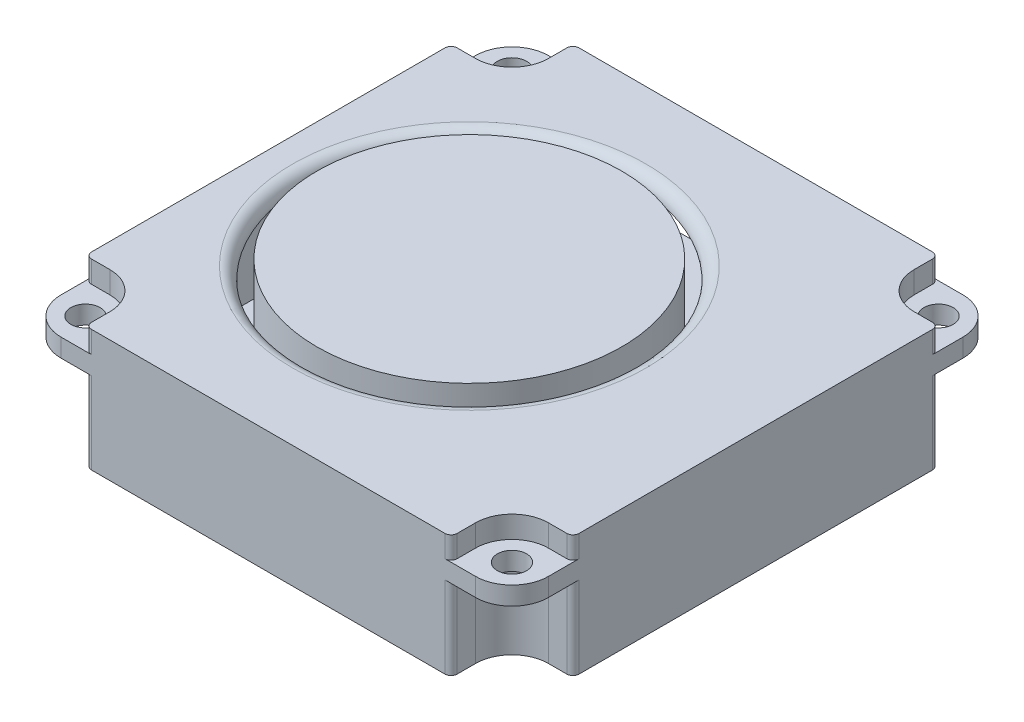
from build123d import *

# Parameters (mm, degrees)
SKETCH_1_W          = 40
SKETCH_1_H          = 40
EXTRUDE_1_DEPTH     = 5
SKETCH_2_W          = 5
SKETCH_2_H          = 5
CUT_EXTRUDE_1_DEPTH = 1.8
SKETCH_4_W          = 5
SKETCH_4_H          = 5
CUT_EXTRUDE_2_DEPTH = 6.7
FILLET_1_R          = 3
HOLE_WIZARD_M2_1_D  = 2.4
FILLET_2_R          = 0.5
CUT_EXTRUDE_3_DEPTH = 4
SKETCH_7_R          = 13.5
CUT_EXTRUDE_4_DEPTH = 9
FILLET_3_R          = 1
SKETCH_9_R          = 12.5
EXTRUDE_2_DEPTH     = 9.5


with BuildPart() as part:
    # ｽｹｯﾁ1 → ﾎﾞｽ - 押し出し1 (new, symmetric)
    with BuildSketch(Plane(origin=(0, 0, 0), x_dir=(1, 0, 0), z_dir=(0, 1, 0))):
        Rectangle(SKETCH_1_W, SKETCH_1_H)
    extrude(amount=EXTRUDE_1_DEPTH, both=True)

    # ｽｹｯﾁ2 → ｶｯﾄ - 押し出し1 (cut)
    with BuildSketch(Plane(origin=(0, 5, 0), x_dir=(1, 0, 0), z_dir=(0, 1, 0))):
        with Locations((17.5, 17.5)):
            Rectangle(SKETCH_2_W, SKETCH_2_H)
        with Locations((-17.5, 17.5)):
            Rectangle(SKETCH_2_W, SKETCH_2_H)
        with Locations((-17.5, -17.5)):
            Rectangle(SKETCH_2_W, SKETCH_2_H)
        with Locations((17.5, -17.5)):
            Rectangle(SKETCH_2_W, SKETCH_2_H)
    extrude(amount=-CUT_EXTRUDE_1_DEPTH, mode=Mode.SUBTRACT)

    # ｽｹｯﾁ4 → ｶｯﾄ - 押し出し2 (cut)
    with BuildSketch(Plane.XZ.offset(5)):
        with Locations((17.5, -17.5)):
            Rectangle(SKETCH_4_W, SKETCH_4_H)
        with Locations((17.5, 17.5)):
            Rectangle(SKETCH_4_W, SKETCH_4_H)
        with Locations((-17.5, 17.5)):
            Rectangle(SKETCH_4_W, SKETCH_4_H)
        with Locations((-17.5, -17.5)):
            Rectangle(SKETCH_4_W, SKETCH_4_H)
    extrude(amount=-CUT_EXTRUDE_2_DEPTH, mode=Mode.SUBTRACT)

    # ﾌｨﾚｯﾄ1
    fillet_1_edges = [part.edges().sort_by_distance(p)[0] for p in [
        (-15, -1.65, -15),
        (20, 2.45, -20),
        (15, 4.1, -15),
        (-20, 2.45, -20),
        (20, 2.45, 20),
        (-20, 2.45, 20),
        (-15, 4.1, -15),
        (-15, 4.1, 15),
        (15, 4.1, 15),
        (15, -1.65, -15),
        (15, -1.65, 15),
        (-15, -1.65, 15),
    ]]
    fillet(fillet_1_edges, radius=FILLET_1_R)

    # M2 すきま穴1 (through all)
    with Locations(Plane(origin=(0, 3.2, 0), x_dir=(1, 0, 0), z_dir=(0, 1, 0))):
        with Locations((-17.5, -17.5), (-17.5, 17.5), (17.5, 17.5), (17.5, -17.5)):
            Hole(HOLE_WIZARD_M2_1_D / 2)

    # ﾌｨﾚｯﾄ2
    fillet_2_edges = [part.edges().sort_by_distance(p)[0] for p in [
        (-15, -1.65, -20),
        (-20, -1.65, -15),
        (20, 4.1, -15),
        (15, 4.1, -20),
        (-15, 4.1, -20),
        (-20, 4.1, -15),
        (-20, 4.1, 15),
        (-15, 4.1, 20),
        (15, 4.1, 20),
        (20, 4.1, 15),
        (20, -1.65, -15),
        (15, -1.65, -20),
        (15, -1.65, 20),
        (20, -1.65, 15),
        (-20, -1.65, 15),
        (-15, -1.65, 20),
    ]]
    fillet(fillet_2_edges, radius=FILLET_2_R)

    # ｽｹｯﾁ8 → ｶｯﾄ - 押し出し3 (cut, symmetric)
    with BuildSketch(Plane(origin=(0, 0, 0), x_dir=(1, 0, 0), z_dir=(0, 1, 0))):
        with BuildLine():
            Line((-14, 19), (-14, 20))
            Line((-14, 20), (14, 20))
            Line((14, 20), (14, 19))
            Line((14, 19), (14, 18))
            ThreePointArc((14, 18), (15.171572875, 15.171572875), (18, 14))
            Line((18, 14), (19, 14))
            Line((19, 14), (19, -14))
            Line((19, -14), (18, -14))
            ThreePointArc((18, -14), (15.171572875, -15.171572875), (14, -18))
            Line((14, -18), (14, -19))
            Line((14, -19), (-14, -19))
            Line((-14, -19), (-14, -18))
            ThreePointArc((-14, -18), (-15.171572875, -15.171572875), (-18, -14))
            Line((-18, -14), (-19, -14))
            Line((-19, -14), (-19, 14))
            Line((-19, 14), (-18, 14))
            ThreePointArc((-18, 14), (-15.171572875, 15.171572875), (-14, 18))
            Line((-14, 18), (-14, 19))
        make_face()
    extrude(amount=CUT_EXTRUDE_3_DEPTH, both=True, mode=Mode.SUBTRACT)

    # ｽｹｯﾁ7 → ｶｯﾄ - 押し出し4 (cut)
    with BuildSketch(Plane.XZ.offset(-5)):
        with Locations(Location((-3.5, 0, 0), (0, 0, 90))):
            Circle(SKETCH_7_R)
    extrude(amount=CUT_EXTRUDE_4_DEPTH, mode=Mode.SUBTRACT)

    # ﾌｨﾚｯﾄ3
    fillet_3_edges = [part.edges().sort_by_distance(p)[0] for p in [
        (-3.5, 5, -13.5),
    ]]
    fillet(fillet_3_edges, radius=FILLET_3_R - 0.0001)  # a hair under: the kernel refuses the full size

    # ｽｹｯﾁ9 → ﾎﾞｽ - 押し出し2 (add)
    with BuildSketch(Plane(origin=(0, -4, 0), x_dir=(1, 0, 0), z_dir=(0, 1, 0))):
        with Locations(Location((-3.5, 0, 0), (0, 0, 270))):
            Circle(SKETCH_9_R)
    extrude(amount=EXTRUDE_2_DEPTH)


solid = part.part
